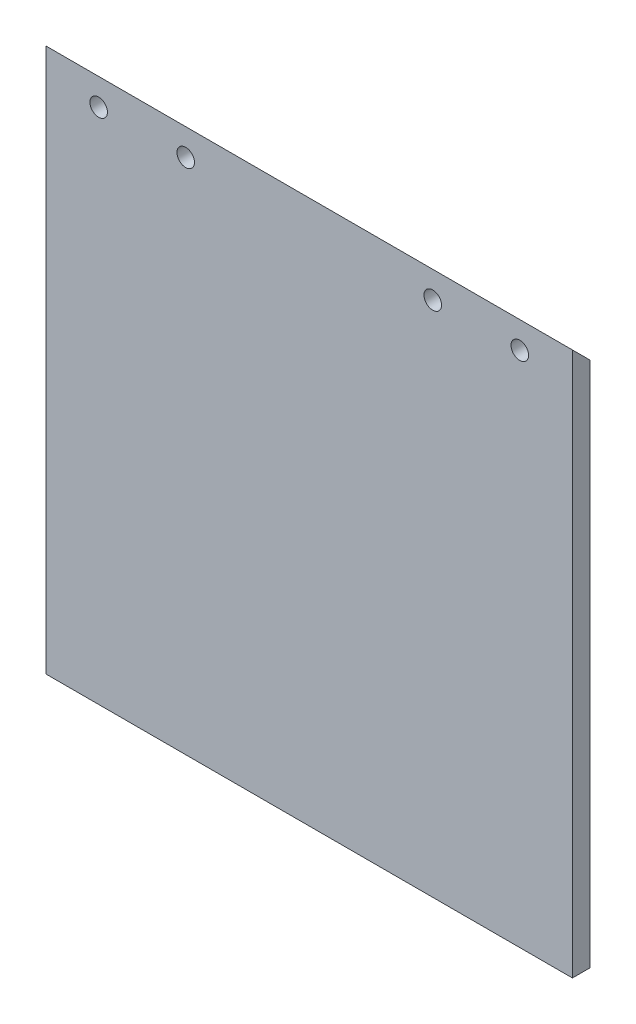
from build123d import *

# Parameters (mm, degrees)
SKETCH1_W           = 95.25
SKETCH1_H           = 98.425
BOSS_EXTRUDE1_DEPTH = 3.175
CHAMFER1_SIZE       = 3.175
SKETCH2_R           = 1.5875
CUT_EXTRUDE1_DEPTH  = 17.78


with BuildPart() as part:
    # Sketch1 → Boss-Extrude1 (new body)
    with BuildSketch(Plane.XY):
        with Locations((-47.625, 49.2125)):
            Rectangle(SKETCH1_W, SKETCH1_H)
    extrude(amount=BOSS_EXTRUDE1_DEPTH)

    # Chamfer1
    chamfer1_edges = [part.edges().sort_by_distance(p)[0] for p in [
        (-47.625, 98.425, 0),
    ]]
    chamfer(chamfer1_edges, length=CHAMFER1_SIZE - 0.0001)  # a hair under: the kernel refuses the full size

    # Sketch2 → Cut-Extrude1 (cut)
    with BuildSketch(Plane.XY.offset(3.175)):
        with Locations((-85.725, 93.599)):
            Circle(SKETCH2_R)
        with Locations((-69.977, 93.599)):
            Circle(SKETCH2_R)
        with Locations((-25.273, 93.599)):
            Circle(SKETCH2_R)
        with Locations((-9.525, 93.599)):
            Circle(SKETCH2_R)
    extrude(amount=-CUT_EXTRUDE1_DEPTH, mode=Mode.SUBTRACT)


solid = part.part
